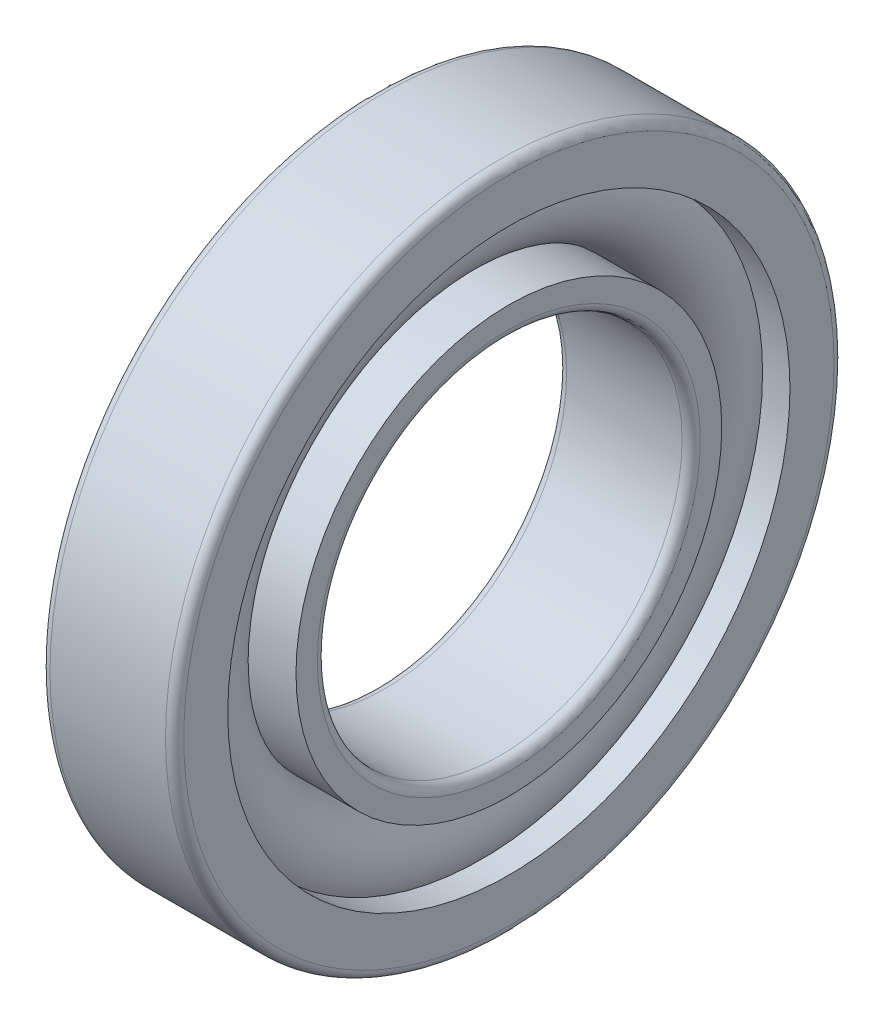
from build123d import *

# Parameters (mm, degrees)
CAGSPISKE_W     = 3.75
CAGSPISKE_H     = 2.5
CAGESPINE_ANGLE = 0.001
BALSIMSKE_R     = 7.5


with BuildPart() as part:
    # CagSpiSke → CageSpine (revolve)
    with BuildSketch(Plane.XY):
        with Locations((0, 42.5)):
            Rectangle(CAGSPISKE_W, CAGSPISKE_H)
    revolve(axis=Axis((-20.6375, 0, 0), (1, 0, 0)), revolution_arc=CAGESPINE_ANGLE)

    # BalSimSke → BallsSimplified (revolve)
    with BuildSketch(Plane.XY):
        with Locations((0, 42.5)):
            Circle(BALSIMSKE_R)
    revolve(axis=Axis((-10, 0, 0), (1, 0, 0)))

    # InnRacSke → InnerRace (revolve)
    with BuildSketch(Plane.XY):
        with BuildLine():
            Line((-6.466306906, 38.75), (-11, 38.75))
            Line((-11, 38.75), (-11, 31.5))
            ThreePointArc((-11, 31.5), (-10.560660172, 30.439339828), (-9.5, 30))
            Line((-9.5, 30), (9.5, 30))
            ThreePointArc((9.5, 30), (10.560660172, 30.439339828), (11, 31.5))
            Line((11, 31.5), (11, 35.025))
            Line((11, 35.025), (0, 35.025))
            ThreePointArc((0, 35.025), (-3.731244765, 36.022852673), (-6.466306906, 38.75))
        make_face()
    revolve(axis=Axis((-20.6375, 0, 0), (1, 0, 0)))

    # OutRacSke → OuterRace (revolve)
    with BuildSketch(Plane.XY):
        with BuildLine():
            Line((0, 49.975), (-11, 49.975))
            Line((-11, 49.975), (-11, 53.5))
            ThreePointArc((-11, 53.5), (-10.560660172, 54.560660172), (-9.5, 55))
            Line((-9.5, 55), (9.5, 55))
            ThreePointArc((9.5, 55), (10.560660172, 54.560660172), (11, 53.5))
            Line((11, 53.5), (11, 46.25))
            Line((11, 46.25), (6.466306906, 46.25))
            ThreePointArc((6.466306906, 46.25), (3.731244765, 48.977147327), (0, 49.975))
        make_face()
    revolve(axis=Axis((-20.6375, 0, 0), (1, 0, 0)))


solid = part.part
